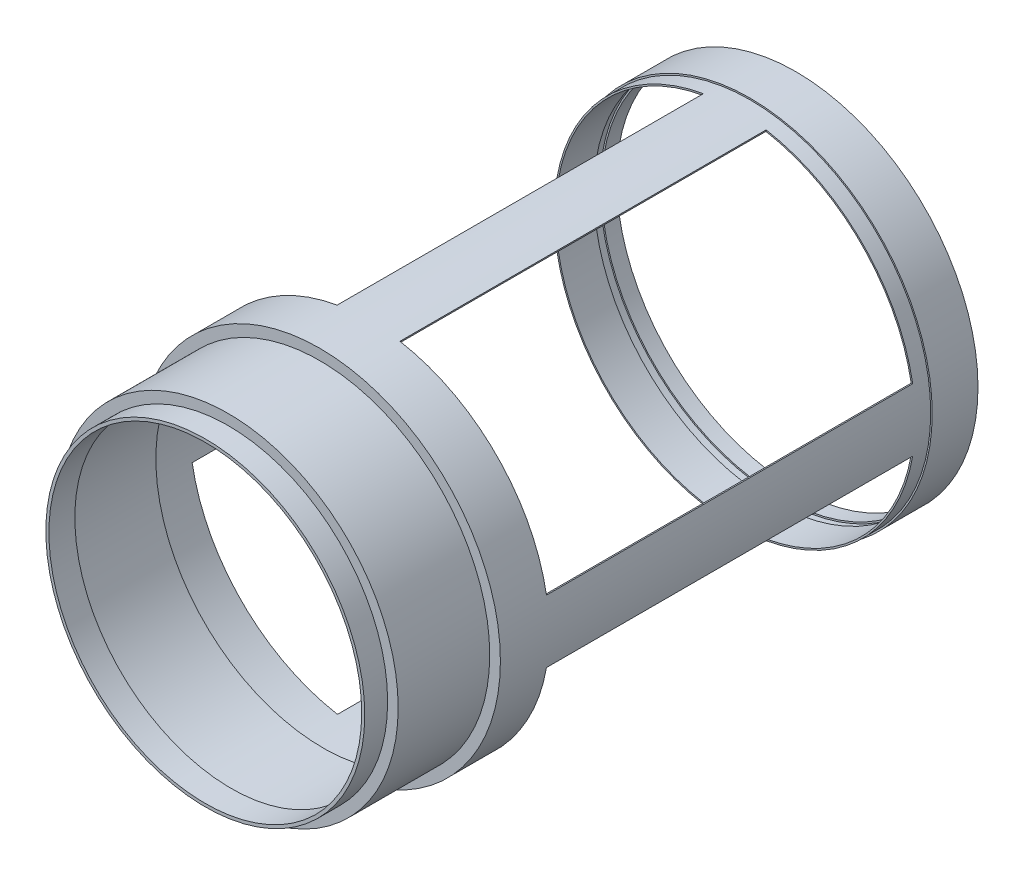
from build123d import *
from build123d.topology import SkipClean

# Parameters (mm, degrees)
SKETCH1_R       = 119.4
SKETCH1_R_2     = 117.4
EXTRUDE1_DEPTH  = 10
SKETCH2_R       = 119.4
SKETCH2_R_2     = 118.4
EXTRUDE2_DEPTH  = 5
SKETCH3_R       = 119.4
SKETCH3_R_2     = 117.4
EXTRUDE3_DEPTH  = 15
SKETCH4_R       = 118.4
SKETCH4_R_2     = 117.4
EXTRUDE4_DEPTH  = 10
EXTRUDE5_DEPTH  = 240
SKETCH6_R       = 118.4
SKETCH6_R_2     = 117.4
EXTRUDE6_DEPTH  = 30
SKETCH7_R       = 118.4
SKETCH7_R_2     = 109.4
EXTRUDE7_DEPTH  = 2
SKETCH8_R       = 111.4
SKETCH8_R_2     = 109.4
EXTRUDE8_DEPTH  = 60
EXTRUDE9_START  = -2
SKETCH9_R       = 111.4
SKETCH9_R_2     = 102.5
EXTRUDE9_DEPTH  = 2
SKETCH10_R      = 104.5
SKETCH10_R_2    = 102.5
EXTRUDE10_DEPTH = 15


with BuildPart() as part:
    # Sketch1 → Extrude1 (new body)
    with BuildSketch(Plane.XY):
        Circle(SKETCH1_R)
        Circle(SKETCH1_R_2, mode=Mode.SUBTRACT)
    extrude(amount=EXTRUDE1_DEPTH)

    # Sketch2 → Extrude2 (add)
    with BuildSketch(Plane.XY.offset(10)):
        Circle(SKETCH2_R)
        Circle(SKETCH2_R_2, mode=Mode.SUBTRACT)
    extrude(amount=EXTRUDE2_DEPTH)

    # Sketch3 → Extrude3 (add)
    with BuildSketch(Plane.XY.offset(15)):
        Circle(SKETCH3_R)
        Circle(SKETCH3_R_2, mode=Mode.SUBTRACT)
    extrude(amount=EXTRUDE3_DEPTH)

    # Sketch4 → Extrude4 (add)
    with BuildSketch(Plane.XY.offset(30)):
        Circle(SKETCH4_R)
        Circle(SKETCH4_R_2, mode=Mode.SUBTRACT)
    extrude(amount=EXTRUDE4_DEPTH)

    # Sketch5 → Extrude5 (add)
    with SkipClean():  # the faces are left unmerged after this step: merging them gives an invalid solid
        with BuildSketch(Plane.XY.offset(40)):
            with BuildLine():
                Line((20.559944236, 116.601237957), (20.386296058, 115.616430204))
                ThreePointArc((20.386296058, 115.616430204), (0, 117.4), (-20.386296058, 115.616430204))
                Line((-20.386296058, 115.616430204), (-20.559944236, 116.601237957))
                ThreePointArc((-20.559944236, 116.601237957), (0, 118.4), (20.559944236, 116.601237957))
            make_face()
            with BuildLine():
                Line((116.601237957, 20.559944236), (115.616430204, 20.386296058))
                ThreePointArc((115.616430204, 20.386296058), (117.4, 0), (115.616430204, -20.386296058))
                Line((115.616430204, -20.386296058), (116.601237957, -20.559944236))
                ThreePointArc((116.601237957, -20.559944236), (118.4, 0), (116.601237957, 20.559944236))
            make_face()
            with BuildLine():
                Line((20.559944236, -116.601237957), (20.386296058, -115.616430204))
                ThreePointArc((20.386296058, -115.616430204), (0, -117.4), (-20.386296058, -115.616430204))
                Line((-20.386296058, -115.616430204), (-20.559944236, -116.601237957))
                ThreePointArc((-20.559944236, -116.601237957), (0, -118.4), (20.559944236, -116.601237957))
            make_face()
            with BuildLine():
                Line((-115.616430204, -20.386296058), (-116.601237957, -20.559944236))
                ThreePointArc((-116.601237957, -20.559944236), (-118.4, 0), (-116.601237957, 20.559944236))
                Line((-116.601237957, 20.559944236), (-115.616430204, 20.386296058))
                ThreePointArc((-115.616430204, 20.386296058), (-117.4, 0), (-115.616430204, -20.386296058))
            make_face()
        extrude(amount=EXTRUDE5_DEPTH)

    # Sketch6 → Extrude6 (add)
    with SkipClean():  # the faces are left unmerged after this step: merging them gives an invalid solid
        with BuildSketch(Plane.XY.offset(280)):
            Circle(SKETCH6_R)
            Circle(SKETCH6_R_2, mode=Mode.SUBTRACT)
        extrude(amount=EXTRUDE6_DEPTH)

    # Sketch7 → Extrude7 (add)
    with SkipClean():  # the faces are left unmerged after this step: merging them gives an invalid solid
        with BuildSketch(Plane.XY.offset(310)):
            Circle(SKETCH7_R)
            Circle(SKETCH7_R_2, mode=Mode.SUBTRACT)
        extrude(amount=EXTRUDE7_DEPTH)

    # Sketch8 → Extrude8 (add)
    with SkipClean():  # the faces are left unmerged after this step: merging them gives an invalid solid
        with BuildSketch(Plane.XY.offset(312)):
            Circle(SKETCH8_R)
            Circle(SKETCH8_R_2, mode=Mode.SUBTRACT)
        extrude(amount=EXTRUDE8_DEPTH)

    # Sketch9 → Extrude9 (add)
    with SkipClean():  # the faces are left unmerged after this step: merging them gives an invalid solid
        with BuildSketch(Plane.XY.offset(372).offset(EXTRUDE9_START)):
            Circle(SKETCH9_R)
            Circle(SKETCH9_R_2, mode=Mode.SUBTRACT)
        extrude(amount=EXTRUDE9_DEPTH)

    # Sketch10 → Extrude10 (add)
    with SkipClean():  # the faces are left unmerged after this step: merging them gives an invalid solid
        with BuildSketch(Plane.XY.offset(372)):
            Circle(SKETCH10_R)
            Circle(SKETCH10_R_2, mode=Mode.SUBTRACT)
        extrude(amount=EXTRUDE10_DEPTH)


solid = part.part
